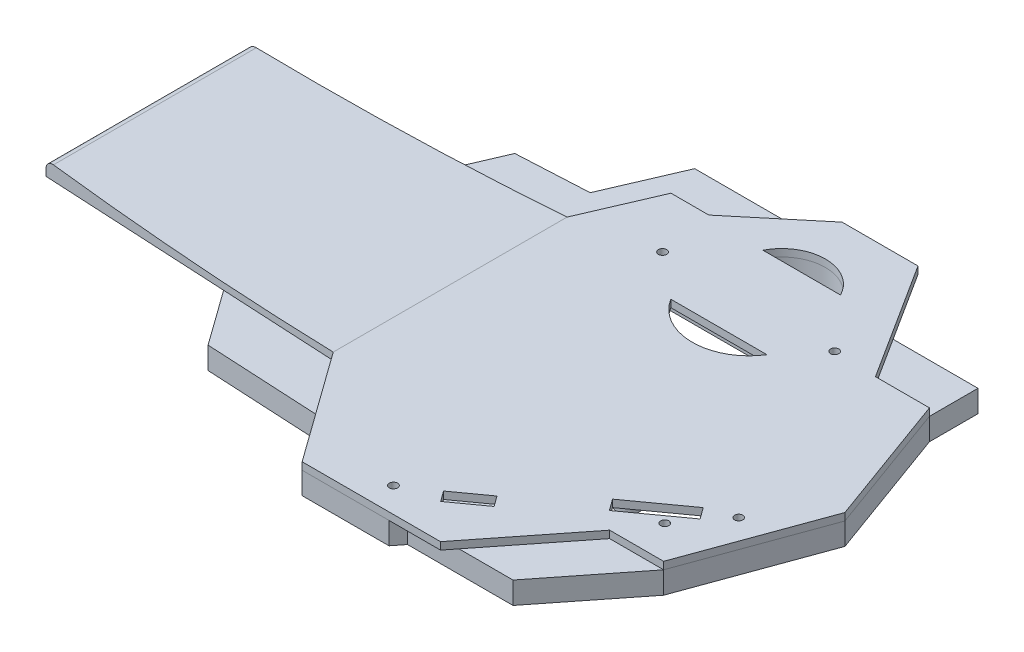
from build123d import *

# Parameters (mm, degrees)
EXTRUDE_1_DEPTH               = 2
EXTRUDE_2_DEPTH               = 2
CUT_EXTRUDE_3_DEPTH           = 202.869395429
CUT_EXTRUDE_3_DEPTH_BACK      = 202.869395429
FILLET_1_R                    = 2
EXTRUDE_4_DEPTH               = 6
CUT_EXTRUDE_7_DEPTH           = 202.98824919
CUT_EXTRUDE_8_DEPTH           = 202.98824919
SKETCH_26_W                   = 1.1303
SKETCH_26_H                   = 10
SKETCH_29_R                   = 3.1
EXTRUDE_14_DEPTH              = 6
EXTRUDE_14_2_DEPTH            = 6
EXTRUDE_14_3_DEPTH            = 6
EXTRUDE_14_4_DEPTH            = 6
SKETCH_32_W                   = 1.1303
SKETCH_32_H                   = 8
HOLE_WIZARD_4_40_4_AT_2_COUNT = 2
HOLE_WIZARD_4_40_4_AT_2_PITCH = 46.853089657
SKETCH_35_W                   = 1.1303
SKETCH_35_H                   = 8
HOLE_WIZARD_4_40_5_AT_2_COUNT = 2
HOLE_WIZARD_4_40_5_AT_2_PITCH = 67.324981434


with BuildPart() as part:
    # 草图2 → 凸台-拉伸1 (new body)
    with BuildSketch(Plane(origin=(0, 0, 0), x_dir=(1, 0, 0), z_dir=(0, 1, 0))):
        Polygon((141.821582241, 68.082690978), (121.161879345, 68.082690978), (101.35099463, 51.608897425), (91.039832206, 51.608897425), (82.527346571, 31.825074964), (0, 27.5), (0, -27.5), (82.527346571, -31.825074964), (104.14664553, -61.917309022), (141.821582241, -61.917309022), (162.133732132, -36.18552755), (176.829545061, -36.18552755), (190, 0), (176.829545061, 36.18552755), (162.133732132, 36.18552755), align=None)
    extrude(amount=EXTRUDE_1_DEPTH)

    # 草图6 → 凸台-拉伸2 (add)
    with BuildSketch(Plane(origin=(0, 2, 0), x_dir=(1, 0, 0), z_dir=(0, 1, 0))):
        Polygon((82.527346571, 31.825074964), (82.527346571, -31.825074964), (0, -27.5), (0, 27.5), align=None)
    extrude(amount=EXTRUDE_2_DEPTH)

    # 草图7 → 切除-拉伸3 (cut, two sides: drawn at the far end of the back side and taken through both)
    with BuildSketch(Plane.XY.offset(-CUT_EXTRUDE_3_DEPTH_BACK)):
        with BuildLine():
            Line((82.527346571, 2), (82.527346571, 30.740821148))
            Line((82.527346571, 30.740821148), (0, 4))
            add(Edge.make_bspline(
                [(82.527346571, 2), (41.215261335, 1.001172546), (0, 4)],
                knots=[0, 0, 0, 1, 1, 1], degree=2))
        make_face()
    extrude(amount=CUT_EXTRUDE_3_DEPTH + CUT_EXTRUDE_3_DEPTH_BACK, mode=Mode.SUBTRACT)

    # 圆角1
    fillet_1_edges = [part.edges().sort_by_distance(p)[0] for p in [
        (0, 4, 13.75),
    ]]
    fillet(fillet_1_edges, radius=FILLET_1_R)

    # 草图18 → 切除-拉伸7 (cut, through all)
    with BuildSketch(Plane(origin=(0, 2, 0), x_dir=(1, 0, 0), z_dir=(0, 1, 0))):
        Polygon((169.563862496, -18.125868021), (155.218286362, -28.471875769), (157.463858458, -31.585543016), (171.809434591, -21.239535267), align=None)
        Polygon((130.302091903, -49.564637909), (132.361562224, -52.420260001), (140.814695434, -46.323873151), (138.755225113, -43.468251059), align=None)
    extrude(amount=-CUT_EXTRUDE_7_DEPTH, mode=Mode.SUBTRACT)


with BuildPart() as body_2:
    # 草图13 → 凸台-拉伸4 (new body)
    with BuildSketch(Plane.XZ):
        Polygon((53.501507434, -30.303895193), (58.412275987, -41.716986195), (77.926898746, -42.739704237), (86.484415452, -62.62818317), (136.164724768, -62.62818317), (144.584081331, -49.40685536), (176.829545061, -49.40685536), (176.829545061, -36.18552755), (190, 0), (176.829545061, 36.18552755), (158.743204348, 59.097615602), (130.016377906, 59.097615602), (127.790568727, 61.917309022), (104.14664553, 61.917309022), (93.336996051, 46.871191993), (61.845926158, 45.220814953), (51.036276678, 30.174697924), (82.527346571, 31.825074964), (171.852914921, 31.825074964), (171.852914921, -31.825074964), (82.527346571, -31.825074964), align=None)
    extrude(amount=EXTRUDE_4_DEPTH)


with BuildPart() as cut_extrude_8_tool:
    # 草图17 → 切除-拉伸8 (new, through all)
    with BuildSketch(Plane(origin=(0, 2, 0), x_dir=(1, 0, 0), z_dir=(0, 1, 0))):
        with BuildLine():
            Line((142.181150975, 26.59529287), (116.011181983, 26.59529287))
            ThreePointArc((116.011181983, 26.59529287), (129.096166479, 19.355270398), (142.181150975, 26.59529287))
        make_face()
        with BuildLine():
            Line((116.98958299, 50.681307574), (138.127410429, 50.681307574))
            ThreePointArc((138.127410429, 50.681307574), (127.55849671, 57.129732827), (116.98958299, 50.681307574))
        make_face()
    extrude(amount=-CUT_EXTRUDE_8_DEPTH)


with BuildPart() as part_1:
    add(part.part)

    # 切除-拉伸8: cut by cut_extrude_8_tool
    add(cut_extrude_8_tool.part, mode=Mode.SUBTRACT)

    # 草图26 → #4-40 螺纹孔3 (revolve, cut)
    with BuildSketch(Plane(origin=(168.015540482, 4, 27.047622993), x_dir=(0, 0, 1), z_dir=(1, 0, 0))):
        with Locations((0.56515, 5)):
            Rectangle(SKETCH_26_W, SKETCH_26_H)
    revolve(axis=Axis((168.015540482, 10.35, 27.047622993), (0, -1, 0)), mode=Mode.SUBTRACT)


with BuildPart() as body_2_1:
    add(body_2.part)

    # 切除-拉伸8: cut by cut_extrude_8_tool
    add(cut_extrude_8_tool.part, mode=Mode.SUBTRACT)


with BuildPart() as body_3:
    # 草图29 → 凸台-拉伸14 (new body)
    with BuildSketch(Plane.XZ):
        with Locations((85.179418504, -19.707526605)):
            Circle(SKETCH_29_R)
    extrude(amount=EXTRUDE_14_DEPTH)


with BuildPart() as body_4:
    # 草图29 → Extrude 14 2 (new body)
    with BuildSketch(Plane.XZ):
        with Locations((150.788762168, -19.707526605)):
            Circle(SKETCH_29_R)
    extrude(amount=EXTRUDE_14_2_DEPTH)


with BuildPart() as body_5:
    # 草图29 → Extrude 14 3 (new body)
    with BuildSketch(Plane.XZ):
        with Locations((150.788762168, 19.707526605)):
            Circle(SKETCH_29_R)
    extrude(amount=EXTRUDE_14_3_DEPTH)


with BuildPart() as body_6:
    # 草图29 → Extrude 14 4 (new body)
    with BuildSketch(Plane.XZ):
        with Locations((85.179418504, 19.707526605)):
            Circle(SKETCH_29_R)
    extrude(amount=EXTRUDE_14_4_DEPTH)


with BuildPart() as hole_wizard_4_40_4_tool:
    # 草图32 → #4-40 螺纹孔4 (revolve)
    with BuildSketch(Plane(origin=(150.602455899, 2, -36.6082143), x_dir=(0, 0, 1), z_dir=(1, 0, 0))):
        with Locations((0.56515, 4)):
            Rectangle(SKETCH_32_W, SKETCH_32_H)
    hole_wizard_4_40_4 = revolve(axis=Axis((150.602455899, 8.35, -36.6082143), (0, -1, 0)))


with BuildPart() as part_2:
    add(part_1.part)

    # #4-40 螺纹孔4: cut by hole_wizard_4_40_4_tool
    add(hole_wizard_4_40_4_tool.part, mode=Mode.SUBTRACT)


with BuildPart() as body_2_2:
    add(body_2_1.part)

    # #4-40 螺纹孔4: cut by hole_wizard_4_40_4_tool
    add(hole_wizard_4_40_4_tool.part, mode=Mode.SUBTRACT)


with BuildPart() as hole_wizard_4_40_4_at_2_tool:
    # #4-40 螺纹孔4 at 2: #4-40 螺纹孔4 ×2
    with Locations(*[(-i * HOLE_WIZARD_4_40_4_AT_2_PITCH, 0, 0) for i in range(1, HOLE_WIZARD_4_40_4_AT_2_COUNT)]):
        add(hole_wizard_4_40_4)


with BuildPart() as part_3:
    add(part_2.part)

    # #4-40 螺纹孔4 at 2: cut by hole_wizard_4_40_4_at_2_tool
    add(hole_wizard_4_40_4_at_2_tool.part, mode=Mode.SUBTRACT)


with BuildPart() as body_2_3:
    add(body_2_2.part)

    # #4-40 螺纹孔4 at 2: cut by hole_wizard_4_40_4_at_2_tool
    add(hole_wizard_4_40_4_at_2_tool.part, mode=Mode.SUBTRACT)


with BuildPart() as hole_wizard_4_40_5_tool:
    # 草图35 → #4-40 螺纹孔5 (revolve)
    with BuildSketch(Plane(origin=(176.735584933, 2, 15.639737001), x_dir=(0, 0, 1), z_dir=(1, 0, 0))):
        with Locations((0.56515, 4)):
            Rectangle(SKETCH_35_W, SKETCH_35_H)
    hole_wizard_4_40_5 = revolve(axis=Axis((176.735584933, 8.35, 15.639737001), (0, -1, 0)))


with BuildPart() as part_4:
    add(part_3.part)

    # #4-40 螺纹孔5: cut by hole_wizard_4_40_5_tool
    add(hole_wizard_4_40_5_tool.part, mode=Mode.SUBTRACT)


with BuildPart() as body_2_4:
    add(body_2_3.part)

    # #4-40 螺纹孔5: cut by hole_wizard_4_40_5_tool
    add(hole_wizard_4_40_5_tool.part, mode=Mode.SUBTRACT)


with BuildPart() as hole_wizard_4_40_5_at_2_tool:
    # #4-40 螺纹孔5 at 2: #4-40 螺纹孔5 ×2
    with Locations(*[Vector(-0.8103060721730659, 0, 0.5860068851126735) * (i * HOLE_WIZARD_4_40_5_AT_2_PITCH) for i in range(1, HOLE_WIZARD_4_40_5_AT_2_COUNT)]):
        add(hole_wizard_4_40_5)


with BuildPart() as part_5:
    add(part_4.part)

    # #4-40 螺纹孔5 at 2: cut by hole_wizard_4_40_5_at_2_tool
    add(hole_wizard_4_40_5_at_2_tool.part, mode=Mode.SUBTRACT)


with BuildPart() as body_2_5:
    add(body_2_4.part)

    # #4-40 螺纹孔5 at 2: cut by hole_wizard_4_40_5_at_2_tool
    add(hole_wizard_4_40_5_at_2_tool.part, mode=Mode.SUBTRACT)


solid = Compound([body_3.part, body_4.part, body_5.part, body_6.part, part_5.part, body_2_5.part])
